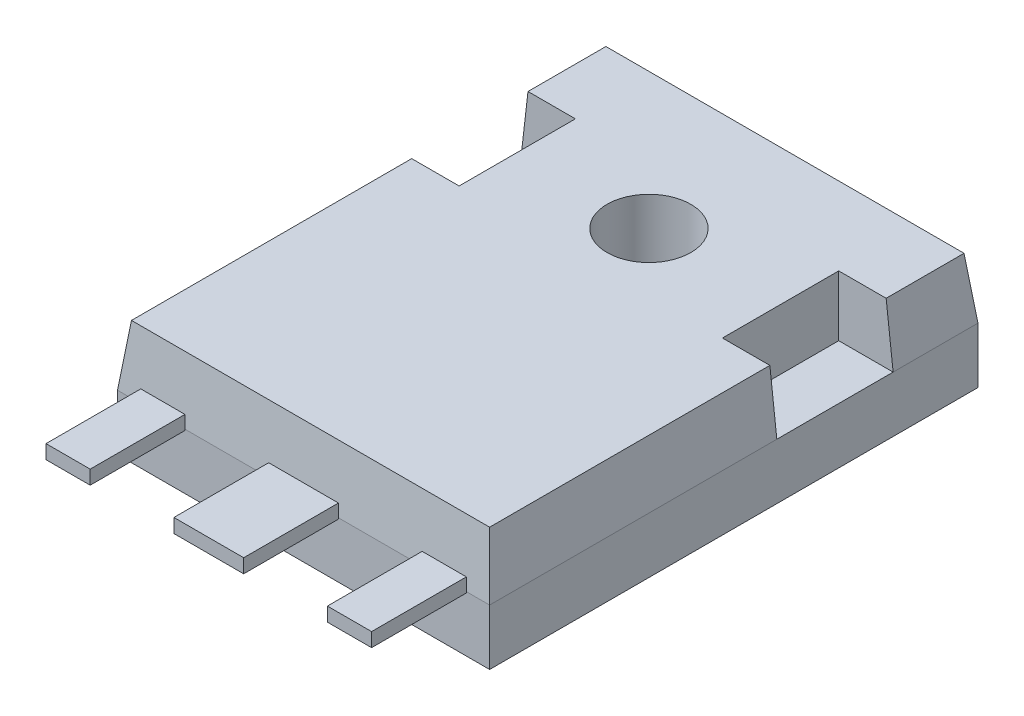
from build123d import *
from OCP.BRepFilletAPI import BRepFilletAPI_MakeChamfer

# Parameters (mm, degrees)
SKETCH1_W           = 16
SKETCH1_H           = 21
BOSS_EXTRUDE1_DEPTH = 5
SKETCH2_W           = 2.338235294
SKETCH2_H           = 5
CUT_EXTRUDE1_DEPTH  = 2.6
SKETCH3_R           = 1.8
CUT_EXTRUDE2_DEPTH  = 15.115594213
CHAMFER1_SIZE       = 2.6
CHAMFER1_SIZE2      = 0.3
SKETCH4_W           = 1.9
SKETCH4_H           = 0.6
SKETCH4_W_2         = 3
BOSS_EXTRUDE2_DEPTH = 4.5
SKETCH5_W           = 1.2
SKETCH5_H           = 0.6
BOSS_EXTRUDE3_DEPTH = 15.5
CHAMFER2_SIZE       = 0.4
CHAMFER3_SIZE       = 1
CHAMFER4_SIZE       = 0.5
SKETCH6_W           = 21.119407152
SKETCH6_H           = 13.185156935
CUT_EXTRUDE3_DEPTH  = 32.669425318
SKETCH7_W           = 15.715970721
SKETCH7_H           = 3.676449557
CUT_EXTRUDE4_DEPTH  = 20.696256624


with BuildPart() as part:
    # Sketch1 → Boss-Extrude1 (new body)
    with BuildSketch(Plane(origin=(0, 0, 0), x_dir=(1, 0, 0), z_dir=(0, 1, 0))):
        Rectangle(SKETCH1_W, SKETCH1_H)
    extrude(amount=BOSS_EXTRUDE1_DEPTH)

    # Sketch2 → Cut-Extrude1 (cut)
    with BuildSketch(Plane(origin=(0, 5, 0), x_dir=(1, 0, 0), z_dir=(0, 1, 0))):
        with Locations((-6.830882353, 4.35)):
            Rectangle(SKETCH2_W, SKETCH2_H)
        with Locations((6.830882353, 4.35)):
            Rectangle(SKETCH2_W, SKETCH2_H)
    extrude(amount=-CUT_EXTRUDE1_DEPTH, mode=Mode.SUBTRACT)

    # Sketch3 → Cut-Extrude2 (cut, through all)
    with BuildSketch(Plane(origin=(0, 5, 0), x_dir=(1, 0, 0), z_dir=(0, 1, 0))):
        with Locations(Location((0, 4.35, 0), (0, 0, 270))):
            Circle(SKETCH3_R)
    extrude(amount=-CUT_EXTRUDE2_DEPTH, mode=Mode.SUBTRACT)

    # Chamfer1: one chamfer whose edges measure the first distance from different faces: ONE call of the kernel's chamfer builder (chamfer() names one face for all edges)
    chamfer1_edges_1 = [part.edges().sort_by_distance(p)[0] for p in [
        (8, 5, 4.325),
        (8, 5, -8.675),
    ]]
    chamfer1_side_1 = [part.faces().sort_by_distance(p)[0] for p in [
        (8, 2.330434783, 0.614673913),
    ]]
    chamfer1_edges_2 = [part.edges().sort_by_distance(p)[0] for p in [
        (-8, 5, 4.325),
        (-8, 5, -8.675),
    ]]
    chamfer1_side_2 = [part.faces().sort_by_distance(p)[0] for p in [
        (-8, 2.330434783, 0.614673913),
    ]]
    chamfer1_edges_3 = [part.edges().sort_by_distance(p)[0] for p in [
        (0, 5, -10.5),
    ]]
    chamfer1_side_3 = [part.faces().sort_by_distance(p)[0] for p in [
        (0, 2.5, -10.5),
    ]]
    chamfer1_edges_4 = [part.edges().sort_by_distance(p)[0] for p in [
        (0, 5, 10.5),
    ]]
    chamfer1_side_4 = [part.faces().sort_by_distance(p)[0] for p in [
        (0, 2.5, 10.5),
    ]]
    chamfer1 = BRepFilletAPI_MakeChamfer(part.part.solid().wrapped)
    for e in chamfer1_edges_1:
        chamfer1.Add(CHAMFER1_SIZE, CHAMFER1_SIZE2, e.wrapped, chamfer1_side_1[0].wrapped)  # the first distance lies on this face
    for e in chamfer1_edges_2:
        chamfer1.Add(CHAMFER1_SIZE, CHAMFER1_SIZE2, e.wrapped, chamfer1_side_2[0].wrapped)  # the first distance lies on this face
    for e in chamfer1_edges_3:
        chamfer1.Add(CHAMFER1_SIZE, CHAMFER1_SIZE2, e.wrapped, chamfer1_side_3[0].wrapped)  # the first distance lies on this face
    for e in chamfer1_edges_4:
        chamfer1.Add(CHAMFER1_SIZE, CHAMFER1_SIZE2, e.wrapped, chamfer1_side_4[0].wrapped)  # the first distance lies on this face
    add(Compound.cast(chamfer1.Shape()), mode=Mode.REPLACE)

    # Sketch4 → Boss-Extrude2 (add)
    with BuildSketch(Plane.XY.offset(10.5)):
        with Locations((-6.05, 2.65)):
            Rectangle(SKETCH4_W, SKETCH4_H)
        with Locations((6.05, 2.65)):
            Rectangle(SKETCH4_W, SKETCH4_H)
        with Locations((0, 2.65)):
            Rectangle(SKETCH4_W_2, SKETCH4_H)
    extrude(amount=BOSS_EXTRUDE2_DEPTH)

    # Sketch5 → Boss-Extrude3 (add)
    with BuildSketch(Plane.XY.offset(15)):
        with Locations((-6.05, 2.65)):
            Rectangle(SKETCH5_W, SKETCH5_H)
        with Locations((0, 2.65)):
            Rectangle(SKETCH5_W, SKETCH5_H)
        with Locations((6.05, 2.65)):
            Rectangle(SKETCH5_W, SKETCH5_H)
    extrude(amount=BOSS_EXTRUDE3_DEPTH)

    # Chamfer2
    # the kernel refuses this chamfer: 0.4 mm, written as the material it adds along each edge
    with BuildSketch(Plane(origin=(-5.45, 2.35, 15), x_dir=(0.9996219169112966, 0, -0.027495876610587302), z_dir=(0, 1, 0))) as chamfer2_piece_1_section:
        Polygon((CHAMFER2_SIZE * 0.999621916911, -CHAMFER2_SIZE * 0.0274958766106), (-CHAMFER2_SIZE * 0.0274958766106, -CHAMFER2_SIZE * 0.999621916911), (0, 0), align=None)
    chamfer2_piece_1 = extrude(amount=0.6, mode=Mode.PRIVATE)
    chamfer2_piece_1 = split(chamfer2_piece_1, bisect_by=Plane(origin=(-5.1, 2.65, 15.135195933), z_dir=(-1, 0, 0)), keep=Keep.TOP, mode=Mode.PRIVATE)
    add(chamfer2_piece_1)
    with BuildSketch(Plane(origin=(6.65, 2.95, 15), x_dir=(0.9996219169112966, 0, -0.027495876610587302), z_dir=(0, -1, 0))) as chamfer2_piece_2_section:
        Polygon((CHAMFER2_SIZE * 0.999621916911, CHAMFER2_SIZE * 0.0274958766106), (-CHAMFER2_SIZE * 0.0274958766106, CHAMFER2_SIZE * 0.999621916911), (0, 0), align=None)
    chamfer2_piece_2 = extrude(amount=0.6, mode=Mode.PRIVATE)
    chamfer2_piece_2 = split(chamfer2_piece_2, bisect_by=Plane(origin=(7, 2.65, 15.135195933), z_dir=(-1, 0, 0)), keep=Keep.TOP, mode=Mode.PRIVATE)
    add(chamfer2_piece_2)
    with BuildSketch(Plane(origin=(5.45, 2.35, 15), x_dir=(-0.9996219169112966, 0, -0.027495876610587302), z_dir=(0, 1, 0))) as chamfer2_piece_3_section:
        Polygon((CHAMFER2_SIZE * 0.999621916911, CHAMFER2_SIZE * 0.0274958766106), (-CHAMFER2_SIZE * 0.0274958766106, CHAMFER2_SIZE * 0.999621916911), (0, 0), align=None)
    chamfer2_piece_3 = extrude(amount=0.6, mode=Mode.PRIVATE)
    chamfer2_piece_3 = split(chamfer2_piece_3, bisect_by=Plane(origin=(5.1, 2.65, 15.135195933), z_dir=(1, 0, 0)), keep=Keep.TOP, mode=Mode.PRIVATE)
    add(chamfer2_piece_3)
    with BuildSketch(Plane(origin=(-6.65, 2.95, 15), x_dir=(-0.9996219169112966, 0, -0.027495876610587302), z_dir=(0, -1, 0))) as chamfer2_piece_4_section:
        Polygon((CHAMFER2_SIZE * 0.999621916911, -CHAMFER2_SIZE * 0.0274958766106), (-CHAMFER2_SIZE * 0.0274958766106, -CHAMFER2_SIZE * 0.999621916911), (0, 0), align=None)
    chamfer2_piece_4 = extrude(amount=0.6, mode=Mode.PRIVATE)
    chamfer2_piece_4 = split(chamfer2_piece_4, bisect_by=Plane(origin=(-7, 2.65, 15.135195933), z_dir=(1, 0, 0)), keep=Keep.TOP, mode=Mode.PRIVATE)
    add(chamfer2_piece_4)

    # Chamfer3
    # the kernel refuses this chamfer: 1 mm, written as the material it adds along each edge
    with BuildSketch(Plane(origin=(0.6, 2.35, 15), x_dir=(0.9996219169112968, 0, -0.027495876610585623), z_dir=(0, 1, 0))) as chamfer3_piece_1_section:
        Polygon((CHAMFER3_SIZE * 0.999621916911, -CHAMFER3_SIZE * 0.0274958766106), (-CHAMFER3_SIZE * 0.0274958766106, -CHAMFER3_SIZE * 0.999621916911), (0, 0), align=None)
    chamfer3_piece_1 = extrude(amount=0.6, mode=Mode.PRIVATE)
    chamfer3_piece_1 = split(chamfer3_piece_1, bisect_by=Plane(origin=(1.5, 2.65, 15.335900747), z_dir=(-1, 0, 0)), keep=Keep.TOP, mode=Mode.PRIVATE)
    add(chamfer3_piece_1)
    with BuildSketch(Plane(origin=(-0.6, 2.95, 15), x_dir=(0.02749587661058645, 0, 0.9996219169112968), z_dir=(0, -1, 0))) as chamfer3_piece_2_section:
        Polygon((CHAMFER3_SIZE * 0.999621916911, CHAMFER3_SIZE * 0.0274958766106), (-CHAMFER3_SIZE * 0.0274958766106, CHAMFER3_SIZE * 0.999621916911), (0, 0), align=None)
    chamfer3_piece_2 = extrude(amount=0.6, mode=Mode.PRIVATE)
    chamfer3_piece_2 = split(chamfer3_piece_2, bisect_by=Plane(origin=(-1.5, 2.65, 15.335900747), z_dir=(1, 0, 0)), keep=Keep.TOP, mode=Mode.PRIVATE)
    add(chamfer3_piece_2)

    # Chamfer4
    chamfer4_edges = [part.edges().sort_by_distance(p)[0] for p in [
        (5.45, 2.65, 30.5),
        (6.65, 2.65, 30.5),
        (0.6, 2.65, 30.5),
        (-0.6, 2.65, 30.5),
        (-5.45, 2.65, 30.5),
        (-6.65, 2.65, 30.5),
    ]]
    chamfer(chamfer4_edges, length=CHAMFER4_SIZE)

    # Sketch6 → Cut-Extrude3 (cut, through all)
    with BuildSketch(Plane(origin=(0, 2.95, 0), x_dir=(1, 0, 0), z_dir=(0, 1, 0))):
        with Locations((0.165735258, -24.347578467)):
            Rectangle(SKETCH6_W, SKETCH6_H)
    extrude(amount=-CUT_EXTRUDE3_DEPTH, mode=Mode.SUBTRACT)

    # Sketch7 → Cut-Extrude4 (cut, through all)
    with BuildSketch(Plane(origin=(0, 2.95, 0), x_dir=(1, 0, 0), z_dir=(0, 1, 0))):
        with Locations((-0.142014639, -16.413224779)):
            Rectangle(SKETCH7_W, SKETCH7_H)
    extrude(amount=-CUT_EXTRUDE4_DEPTH, mode=Mode.SUBTRACT)


solid = part.part
